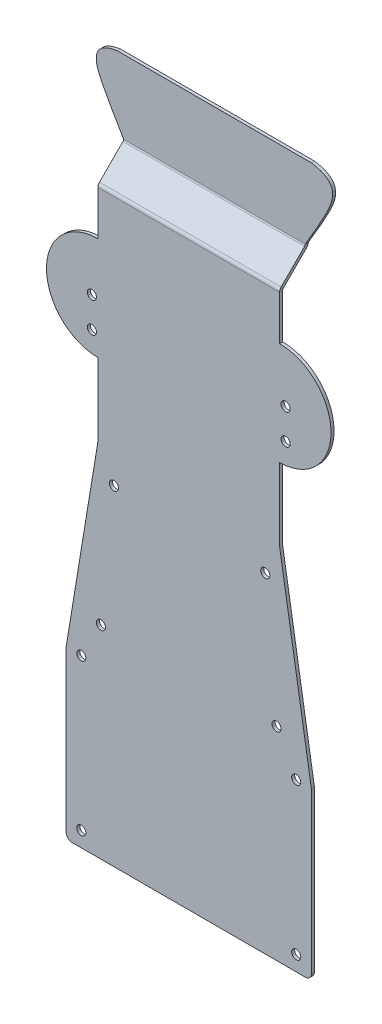
from build123d import *

# Parameters (mm, degrees)
BASE_FLANGE1_DEPTH           = 1
EDGE_FLANGE1_STRIP_CUT_DEPTH = 60
EDGE_FLANGE1_DEPTH           = 60
EDGE_FLANGE2_STRIP_CUT_DEPTH = 60
EDGE_FLANGE2_DEPTH           = 60
SKETCH14_W                   = 1
SKETCH14_H                   = 24.280676727
BOSS_EXTRUDE1_DEPTH          = 9
SKETCH15_W                   = 1
SKETCH15_H                   = 24.280676727
BOSS_EXTRUDE2_DEPTH          = 9
CUT_EXTRUDE1_START           = -1
CUT_EXTRUDE1_DEPTH           = 1
FILLET2_R                    = 2
SKETCH17_R                   = 1.5
CUT_EXTRUDE2_DEPTH           = 231.487770095
SKETCH18_R                   = 1.5
CUT_EXTRUDE3_DEPTH           = 231.487770095
SKETCH19_R                   = 1.5
CUT_EXTRUDE4_DEPTH           = 231.487770095


# Read off the part's stored shape, not the designer's step: Cut-Extrude1
# Sheet-metal steps are written as plain solids
with BuildPart() as part:
    # Sketch1 → Base-Flange1 (new body)
    with BuildSketch(Plane.XY):
        with BuildLine():
            Line((-40.5, 0), (40.5, 0))
            Line((40.5, 0), (40.5, 55))
            Line((40.5, 55), (30, 119))
            Line((30, 119), (30, 143))
            ThreePointArc((30, 143), (47, 160), (30, 177))
            Line((30, 177), (30, 192))
            Line((30, 192), (-30, 192))
            Line((-30, 192), (-30, 177))
            ThreePointArc((-30, 177), (-47, 160), (-30, 143))
            Line((-30, 143), (-30, 119))
            Line((-30, 119), (-40.5, 55))
            Line((-40.5, 55), (-40.5, 0))
        make_face()
    extrude(amount=-BASE_FLANGE1_DEPTH)

    # Edge-Flange1 strip (across the edge) → Edge-Flange1 strip cut (cut)
    with BuildSketch(Plane(origin=(-30, 192, -1), x_dir=(0, -0.7071067811865438, -0.7071067811865512), z_dir=(1, 0, 0))):
        Polygon((-4.361498471, 2.947284909), (-0.491361636, -0.922851926), (0.215745145, -0.215745145), (-3.65439169, 3.65439169), align=None)
    extrude(amount=EDGE_FLANGE1_STRIP_CUT_DEPTH, mode=Mode.SUBTRACT)

    # Edge-Flange1 section (across the edge) → Edge-Flange1 (add)
    with BuildSketch(Plane(origin=(-30, 192, -1), x_dir=(0, -0.7071067811865438, -0.7071067811865512), z_dir=(1, 0, 0))):
        with BuildLine():
            Line((-1, 0.30510971), (-1, 11.585786438))
            Line((-1, 11.585786438), (0, 11.585786438))
            Line((0, 11.585786438), (0, 0.30510971))
            ThreePointArc((0, 0.30510971), (0.056070336, 0.023225094), (0.215745145, -0.215745145))
            Line((0.215745145, -0.215745145), (-0.491361636, -0.922851926))
            ThreePointArc((-0.491361636, -0.922851926), (-0.867809196, -0.359458339), (-1, 0.30510971))
        make_face()
    extrude(amount=EDGE_FLANGE1_DEPTH)

    # Edge-Flange2 strip (across the edge) → Edge-Flange2 strip cut (cut)
    with BuildSketch(Plane(origin=(30, 200.899494937, -8.485281374), x_dir=(0, 0, 1), z_dir=(-1, 0, 0))):
        Polygon((-4.361498471, 2.947284909), (-0.491361636, -0.922851926), (0.215745145, -0.215745145), (-3.65439169, 3.65439169), align=None)
    extrude(amount=EDGE_FLANGE2_STRIP_CUT_DEPTH, mode=Mode.SUBTRACT)

    # Edge-Flange2 section (across the edge) → Edge-Flange2 (add)
    with BuildSketch(Plane(origin=(30, 200.899494937, -8.485281374), x_dir=(0, 0, 1), z_dir=(-1, 0, 0))):
        with BuildLine():
            Line((-1, 0.30510971), (-1, 24.585786438))
            Line((-1, 24.585786438), (0, 24.585786438))
            Line((0, 24.585786438), (0, 0.30510971))
            ThreePointArc((0, 0.30510971), (0.056070336, 0.023225094), (0.215745145, -0.215745145))
            Line((0.215745145, -0.215745145), (-0.491361636, -0.922851926))
            ThreePointArc((-0.491361636, -0.922851926), (-0.867809196, -0.359458339), (-1, 0.30510971))
        make_face()
    extrude(amount=EDGE_FLANGE2_DEPTH)

    # Sketch14 → Boss-Extrude1 (add)
    with BuildSketch(Plane(origin=(30, 0, 0), x_dir=(0, 0, -1), z_dir=(1, 0, 0))):
        with Locations((8.985281374, 213.344943011)):
            Rectangle(SKETCH14_W, SKETCH14_H)
    extrude(amount=BOSS_EXTRUDE1_DEPTH)

    # Sketch15 → Boss-Extrude2 (add)
    with BuildSketch(Plane.ZY.offset(30)):
        with Locations((-8.985281374, 213.344943011)):
            Rectangle(SKETCH15_W, SKETCH15_H)
    extrude(amount=BOSS_EXTRUDE2_DEPTH)

    # Cut-Extrude1 outline → Cut-Extrude1 (cut)
    with BuildSketch(Plane(origin=(0, 0, -9.485281374), x_dir=(-1, 0, 0), z_dir=(0, 0, -1)).offset(CUT_EXTRUDE1_START)):
        with BuildLine():
            Line((39, 201.204604647), (39, 219.240417061))
            add(Edge.make_bspline(
                [(30, 201.204604647), (31.71398357, 204.270148777), (35.194685688, 209.766177292), (38.784446875, 217.082662856), (39, 219.240417061)],
                knots=[0, 0, 0, 0, 0.463591524, 0.691545034, 0.691545034, 0.691545034, 0.691545034], degree=3))
            Line((30, 201.204604647), (39, 201.204604647))
        make_face()
        with BuildLine():
            add(Edge.make_bspline(
                [(39, 220.550582239), (38.73699137, 222.877809464), (36.937902842, 224.748781209), (32.132158029, 225.485281374)],
                knots=[0.73898762, 0.73898762, 0.73898762, 0.73898762, 1, 1, 1, 1], degree=3))
            Line((39, 220.550582239), (39, 225.485281374))
            Line((39, 225.485281374), (32.132158029, 225.485281374))
        make_face()
    cut_extrude1 = extrude(amount=CUT_EXTRUDE1_DEPTH, mode=Mode.SUBTRACT)

    # Mirror1: Cut-Extrude1 across plane
    add(cut_extrude1.mirror(Plane(origin=(0, 0, 0), x_dir=(0, 0, 1), z_dir=(1, 0, 0))), mode=Mode.SUBTRACT)

    # Fillet2
    fillet2_edges = [part.edges().sort_by_distance(p)[0] for p in [
        (40.5, 0, -0.5),
        (-40.5, 0, -0.5),
    ]]
    fillet(fillet2_edges, radius=FILLET2_R)

    # Sketch17 → Cut-Extrude2 (cut, through all)
    with BuildSketch(Plane(origin=(0, 0, -1), x_dir=(-1, 0, 0), z_dir=(0, 0, -1))):
        with Locations((-35.5, 5)):
            Circle(SKETCH17_R)
        with Locations((35.5, 5)):
            Circle(SKETCH17_R)
        with Locations((-35.5, 55)):
            Circle(SKETCH17_R)
        with Locations((35.5, 55)):
            Circle(SKETCH17_R)
    extrude(amount=-CUT_EXTRUDE2_DEPTH, mode=Mode.SUBTRACT)

    # Sketch18 → Cut-Extrude3 (cut, through all)
    with BuildSketch(Plane(origin=(0, 0, -1), x_dir=(-1, 0, 0), z_dir=(0, 0, -1))):
        with Locations((-29, 67)):
            Circle(SKETCH18_R)
        with Locations((29, 67)):
            Circle(SKETCH18_R)
        with Locations((-25.274058899, 109)):
            Circle(SKETCH18_R)
        with Locations((24.725941101, 109)):
            Circle(SKETCH18_R)
    extrude(amount=-CUT_EXTRUDE3_DEPTH, mode=Mode.SUBTRACT)

    # Sketch19 → Cut-Extrude4 (cut, through all)
    with BuildSketch(Plane(origin=(0, 0, -1), x_dir=(-1, 0, 0), z_dir=(0, 0, -1))):
        with Locations((-32, 160)):
            Circle(SKETCH19_R)
        with Locations((32, 160)):
            Circle(SKETCH19_R)
        with Locations((-32, 150)):
            Circle(SKETCH19_R)
        with Locations((32, 150)):
            Circle(SKETCH19_R)
    extrude(amount=-CUT_EXTRUDE4_DEPTH, mode=Mode.SUBTRACT)


solid = part.part
